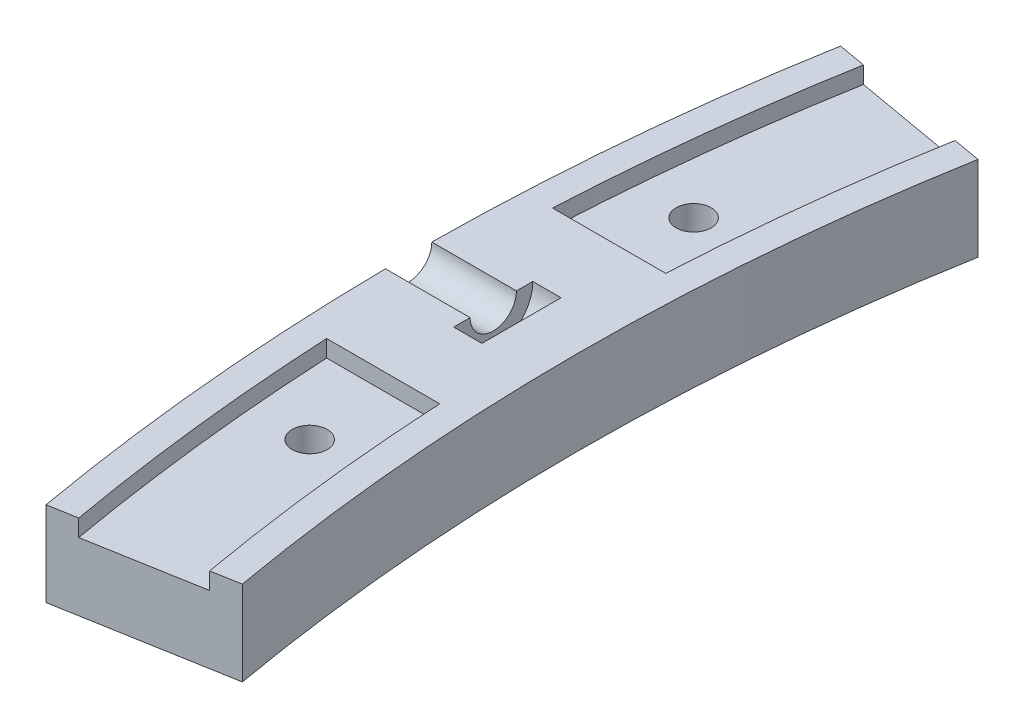
from build123d import *

# Parameters (mm, degrees)
BOSS_EXTRUDE1_DEPTH        = 7.5
CUT_EXTRUDE1_DEPTH         = 1.5
SKETCH4_R                  = 3.5
CUT_EXTRUDE3_DEPTH         = 2.5
SKETCH5_R                  = 2.05
CUT_EXTRUDE4_DEPTH         = 38.414330746
F_3_1_3_1_DIAMETER_HOLE1_D = 3.1


with BuildPart() as part:
    # Sketch1 → Boss-Extrude1 (new body)
    with BuildSketch(Plane(origin=(0, 0, 0), x_dir=(1, 0, 0), z_dir=(0, 1, 0))):
        with BuildLine():
            Line((-199.423569985, 35.163755978), (-184.65145369, 32.559033313))
            ThreePointArc((-184.65145369, 32.559033313), (-187.5, 0), (-184.65145369, -32.559033313))
            Line((-184.65145369, -32.559033313), (-199.423569985, -35.163755978))
            ThreePointArc((-199.423569985, -35.163755978), (-202.5, 0), (-199.423569985, 35.163755978))
        make_face()
    extrude(amount=BOSS_EXTRUDE1_DEPTH)

    # Sketch2 → Cut-Extrude1 (cut)
    with BuildSketch(Plane(origin=(0, 7.5, 0), x_dir=(1, 0, 0), z_dir=(0, 1, 0))):
        with BuildLine():
            Line((-187.113473072, 32.993153757), (-196.961550602, 34.729635533))
            ThreePointArc((-196.961550602, 34.729635533), (-198.7407137, 22.408228804), (-199.749843554, 10))
            Line((-199.749843554, 10), (-189.73665961, 10))
            ThreePointArc((-189.73665961, 10), (-188.775466906, 21.536552519), (-187.113473072, 32.993153757))
        make_face()
        with BuildLine():
            Line((-189.73665961, -10), (-199.749843554, -10))
            ThreePointArc((-199.749843554, -10), (-198.7407137, -22.408228804), (-196.961550602, -34.729635533))
            Line((-196.961550602, -34.729635533), (-187.113473072, -32.993153757))
            ThreePointArc((-187.113473072, -32.993153757), (-188.775466906, -21.536552519), (-189.73665961, -10))
        make_face()
    extrude(amount=-CUT_EXTRUDE1_DEPTH, mode=Mode.SUBTRACT)

    # Sketch4 → Cut-Extrude3 (cut)
    with BuildSketch(Plane(origin=(-195, 0, 0), x_dir=(0, 0, -1), z_dir=(1, 0, 0))):
        with Locations((0, 7.5)):
            Circle(SKETCH4_R)
    extrude(amount=CUT_EXTRUDE3_DEPTH, mode=Mode.SUBTRACT)

    # Sketch5 → Cut-Extrude4 (cut, through all)
    with BuildSketch(Plane(origin=(-195, 0, 0), x_dir=(0, 0, -1), z_dir=(1, 0, 0))):
        with Locations((0, 7.5)):
            Circle(SKETCH5_R)
    extrude(amount=-CUT_EXTRUDE4_DEPTH, mode=Mode.SUBTRACT)

    # Ø3.1 (3.1) Diameter Hole1 (through all)
    with Locations(Plane(origin=(0, 0, 0), x_dir=(-1, 0, 0), z_dir=(0, -1, 0))):
        with Locations((194.257966128, -16.995369836), (194.257966128, 16.995369836)):
            Hole(F_3_1_3_1_DIAMETER_HOLE1_D / 2)


solid = part.part
